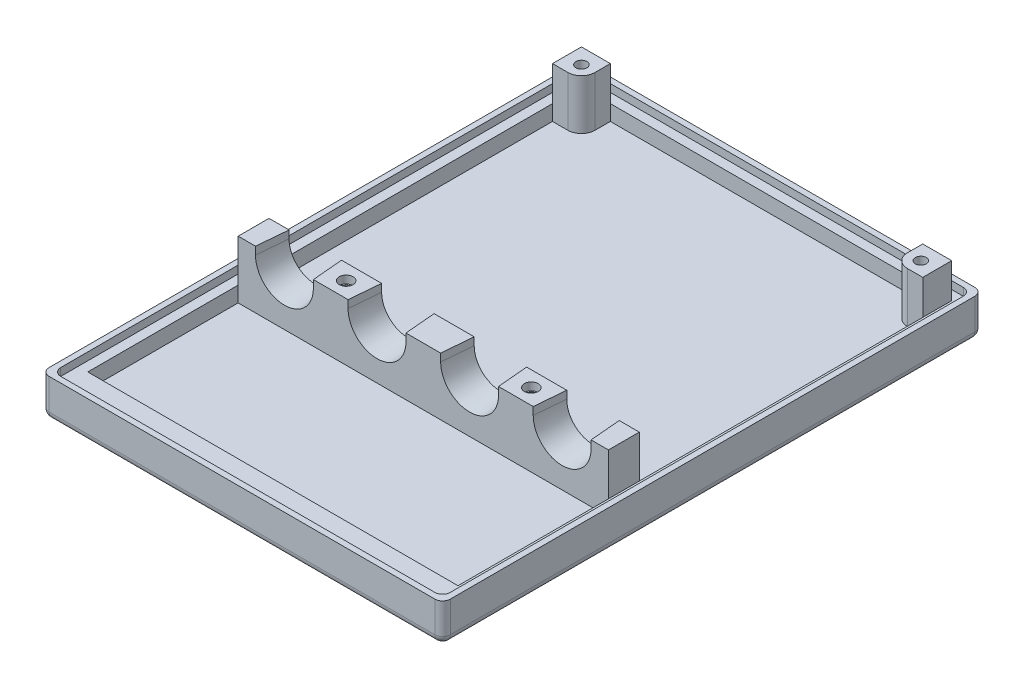
from build123d import *

# Parameters (mm, degrees)
SKETCH1_W                     = 82.55
SKETCH1_H                     = 111.125
BOSS_EXTRUDE1_DEPTH           = 7.9375
SKETCH3_W                     = 76.2
SKETCH3_H                     = 101.6
CUT_EXTRUDE1_DEPTH            = 4.7625
SKETCH4_W                     = 76.2
SKETCH4_H                     = 6.35
BOSS_EXTRUDE2_DEPTH           = 4.7625
SKETCH5_W                     = 76.2
SKETCH5_H                     = 6.35
BOSS_EXTRUDE3_DEPTH           = 5.5499
SKETCH7_R                     = 5.953125
CUT_EXTRUDE2_DEPTH            = 6.35
CUT_EXTRUDE2_DRAFT            = -5
CUT_EXTRUDE2_PROFILE_2_DEPTH  = 6.35
CUT_EXTRUDE2_PROFILE_2_DRAFT  = -5
CUT_EXTRUDE2_PROFILE_3_DEPTH  = 6.35
CUT_EXTRUDE2_PROFILE_3_DRAFT  = -5
CUT_EXTRUDE2_PROFILE_4_DEPTH  = 6.35
CUT_EXTRUDE2_PROFILE_4_DRAFT  = -5
FILLET1_R                     = 1.5875
F_4_40_TAPPED_HOLE4_D         = 2.2606
F_4_40_TAPPED_HOLE4_DEPTH     = 5.588
F_4_40_TAPPED_HOLE4_TIP       = 0.679152758
SKETCH29_W                    = 80.16875
SKETCH29_H                    = 108.74375
SKETCH29_W_2                  = 76.2
SKETCH29_H_2                  = 101.6
CUT_EXTRUDE8_DEPTH            = 1.5875
FILLET3_R                     = 1.5875
BOSS_EXTRUDE11_DEPTH          = 1.5875
F_4_40_START                  = 13.4874
F_4_40_TAPPED_HOLE7_OUTLINE_R = 1.4224
F_4_40_TAPPED_HOLE7_DEPTH     = 1.5875
SKETCH42_W                    = 0.652371877
SKETCH42_H                    = 1.304778899
SKETCH42_W_2                  = 0.652345509
SKETCH42_W_3                  = 0.652363072
SKETCH42_H_2                  = 1.304668087
SKETCH42_W_4                  = 0.978571653
SKETCH42_H_3                  = 0.65256534
SKETCH42_W_5                  = 3.914136188
SKETCH42_H_4                  = 1.304397517
CUT_EXTRUDE11_DEPTH           = 0.79375
SKETCH44_W                    = 0.326213032
SKETCH44_H                    = 0.326144875
BOSS_EXTRUDE13_DEPTH          = 0.79375
SKETCH44_W_2                  = 1.304696491
SKETCH44_H_2                  = 0.652319029
BOSS_EXTRUDE13_2_DEPTH        = 0.79375
SKETCH44_W_3                  = 4.566463461
SKETCH44_H_3                  = 0.6524024
BOSS_EXTRUDE13_3_DEPTH        = 0.79375
BOSS_EXTRUDE13_4_DEPTH        = 0.79375


# Read off the part's stored shape, not the designer's step: #4-40 Tapped Hole7
with BuildPart() as part:
    # Sketch1 → Boss-Extrude1 (new body)
    with BuildSketch(Plane(origin=(0, 0, 0), x_dir=(1, 0, 0), z_dir=(0, 1, 0))):
        Rectangle(SKETCH1_W, SKETCH1_H)
    extrude(amount=BOSS_EXTRUDE1_DEPTH)

    # Sketch3 → Cut-Extrude1 (cut)
    with BuildSketch(Plane(origin=(0, 7.9375, 0), x_dir=(-1, 0, 0), z_dir=(0, 1, 0))):
        with Locations((0, -1.5875)):
            Rectangle(SKETCH3_W, SKETCH3_H)
    extrude(amount=-CUT_EXTRUDE1_DEPTH, mode=Mode.SUBTRACT)

    # Sketch4 → Boss-Extrude2 (add)
    with BuildSketch(Plane(origin=(0, 3.175, 0), x_dir=(-1, 0, 0), z_dir=(0, 1, 0))):
        with Locations((0, 15.08125)):
            Rectangle(SKETCH4_W, SKETCH4_H)
        with BuildLine():
            Line((34.925, -46.434375), (38.1, -46.434375))
            Line((38.1, -46.434375), (38.1, -52.3875))
            Line((38.1, -52.3875), (32.146875, -52.3875))
            Line((32.146875, -52.3875), (32.146875, -49.2125))
            ThreePointArc((32.146875, -49.2125), (32.960568974, -47.248068974), (34.925, -46.434375))
        make_face()
        with BuildLine():
            Line((-32.146875, -49.2125), (-32.146875, -52.3875))
            Line((-32.146875, -52.3875), (-38.1, -52.3875))
            Line((-38.1, -52.3875), (-38.1, -46.434375))
            Line((-38.1, -46.434375), (-34.925, -46.434375))
            ThreePointArc((-34.925, -46.434375), (-32.960568974, -47.248068974), (-32.146875, -49.2125))
        make_face()
    extrude(amount=BOSS_EXTRUDE2_DEPTH)

    # Sketch5 → Boss-Extrude3 (add)
    with BuildSketch(Plane(origin=(0, 7.9375, 0), x_dir=(-1, 0, 0), z_dir=(0, 1, 0))):
        with Locations((0, 15.08125)):
            Rectangle(SKETCH5_W, SKETCH5_H)
        with BuildLine():
            Line((34.925, -46.434375), (38.1, -46.434375))
            Line((38.1, -46.434375), (38.1, -52.3875))
            Line((38.1, -52.3875), (32.146875, -52.3875))
            Line((32.146875, -52.3875), (32.146875, -49.2125))
            ThreePointArc((32.146875, -49.2125), (32.960568974, -47.248068974), (34.925, -46.434375))
        make_face()
        with BuildLine():
            Line((-32.146875, -49.2125), (-32.146875, -52.3875))
            Line((-32.146875, -52.3875), (-38.1, -52.3875))
            Line((-38.1, -52.3875), (-38.1, -46.434375))
            Line((-38.1, -46.434375), (-34.925, -46.434375))
            ThreePointArc((-34.925, -46.434375), (-32.960568974, -47.248068974), (-32.146875, -49.2125))
        make_face()
    extrude(amount=BOSS_EXTRUDE3_DEPTH)


with BuildPart() as cut_extrude2_tool:
    # Sketch7 → Cut-Extrude2 (with draft: the straight prism first)
    with BuildSketch(Plane.XY.offset(18.25625)):
        with Locations((-28.575, 13.4874)):
            Circle(SKETCH7_R)
    extrude(amount=-CUT_EXTRUDE2_DEPTH)
    # Cut-Extrude2: the draft: its side faces are tilted about the plane it starts from
    cut_extrude2_sides = [cut_extrude2_tool.faces().sort_by_distance(p)[0] for p in [
        (-34.528125, 13.4874, 15.08125),
    ]]
    draft(cut_extrude2_sides, Plane.XY.offset(18.25625), CUT_EXTRUDE2_DRAFT)


with BuildPart() as part_1:
    add(part.part)

    # Cut-Extrude2: cut by cut_extrude2_tool
    add(cut_extrude2_tool.part, mode=Mode.SUBTRACT)


with BuildPart() as cut_extrude2_profile_2_tool:
    # Sketch7 → Cut-Extrude2 profile 2 (with draft: the straight prism first)
    with BuildSketch(Plane.XY.offset(18.25625)):
        with Locations((-9.525, 13.4874)):
            Circle(SKETCH7_R)
    extrude(amount=-CUT_EXTRUDE2_PROFILE_2_DEPTH)
    # Cut-Extrude2 profile 2: the draft: its side faces are tilted about the plane it starts from
    cut_extrude2_profile_2_sides = [cut_extrude2_profile_2_tool.faces().sort_by_distance(p)[0] for p in [
        (-15.478125, 13.4874, 15.08125),
    ]]
    draft(cut_extrude2_profile_2_sides, Plane.XY.offset(18.25625), CUT_EXTRUDE2_PROFILE_2_DRAFT)


with BuildPart() as part_2:
    add(part_1.part)

    # Cut-Extrude2 profile 2: cut by cut_extrude2_profile_2_tool
    add(cut_extrude2_profile_2_tool.part, mode=Mode.SUBTRACT)


with BuildPart() as cut_extrude2_profile_3_tool:
    # Sketch7 → Cut-Extrude2 profile 3 (with draft: the straight prism first)
    with BuildSketch(Plane.XY.offset(18.25625)):
        with Locations((9.525, 13.4874)):
            Circle(SKETCH7_R)
    extrude(amount=-CUT_EXTRUDE2_PROFILE_3_DEPTH)
    # Cut-Extrude2 profile 3: the draft: its side faces are tilted about the plane it starts from
    cut_extrude2_profile_3_sides = [cut_extrude2_profile_3_tool.faces().sort_by_distance(p)[0] for p in [
        (3.571875, 13.4874, 15.08125),
    ]]
    draft(cut_extrude2_profile_3_sides, Plane.XY.offset(18.25625), CUT_EXTRUDE2_PROFILE_3_DRAFT)


with BuildPart() as part_3:
    add(part_2.part)

    # Cut-Extrude2 profile 3: cut by cut_extrude2_profile_3_tool
    add(cut_extrude2_profile_3_tool.part, mode=Mode.SUBTRACT)


with BuildPart() as cut_extrude2_profile_4_tool:
    # Sketch7 → Cut-Extrude2 profile 4 (with draft: the straight prism first)
    with BuildSketch(Plane.XY.offset(18.25625)):
        with Locations((28.575, 13.4874)):
            Circle(SKETCH7_R)
    extrude(amount=-CUT_EXTRUDE2_PROFILE_4_DEPTH)
    # Cut-Extrude2 profile 4: the draft: its side faces are tilted about the plane it starts from
    cut_extrude2_profile_4_sides = [cut_extrude2_profile_4_tool.faces().sort_by_distance(p)[0] for p in [
        (22.621875, 13.4874, 15.08125),
    ]]
    draft(cut_extrude2_profile_4_sides, Plane.XY.offset(18.25625), CUT_EXTRUDE2_PROFILE_4_DRAFT)


with BuildPart() as part_4:
    add(part_3.part)

    # Cut-Extrude2 profile 4: cut by cut_extrude2_profile_4_tool
    add(cut_extrude2_profile_4_tool.part, mode=Mode.SUBTRACT)

    # Fillet1
    fillet1_edges = [part_4.edges().sort_by_distance(p)[0] for p in [
        (0, 0, 55.5625),
        (-41.275, 0, 0),
        (0, 0, -55.5625),
        (41.275, 0, 0),
        (41.275, 3.96875, 55.5625),
        (-41.275, 3.96875, 55.5625),
        (-41.275, 3.96875, -55.5625),
        (41.275, 3.96875, -55.5625),
    ]]
    fillet(fillet1_edges, radius=FILLET1_R)

    # #4-40 Tapped Hole4
    with Locations(Plane(origin=(0, 13.4874, 0), x_dir=(-1, 0, 0), z_dir=(0, 1, 0))):
        with Locations((-19.05, 15.08125), (19.05, 15.08125), (34.925, -49.2125), (-34.925, -49.2125)):
            Hole(F_4_40_TAPPED_HOLE4_D / 2, depth=F_4_40_TAPPED_HOLE4_DEPTH)
            with Locations((0, 0, -(F_4_40_TAPPED_HOLE4_DEPTH + F_4_40_TAPPED_HOLE4_TIP / 2))):  # 118° drill point
                Cone(0, F_4_40_TAPPED_HOLE4_D / 2, F_4_40_TAPPED_HOLE4_TIP, mode=Mode.SUBTRACT)

    # Sketch29 → Cut-Extrude8 (cut)
    with BuildSketch(Plane(origin=(0, 7.9375, 0), x_dir=(1, 0, 0), z_dir=(0, 1, 0))):
        Rectangle(SKETCH29_W, SKETCH29_H)
        with Locations((0, 1.5875)):
            Rectangle(SKETCH29_W_2, SKETCH29_H_2, mode=Mode.SUBTRACT)
    extrude(amount=-CUT_EXTRUDE8_DEPTH, mode=Mode.SUBTRACT)

    # Fillet3
    fillet3_edges = [part_4.edges().sort_by_distance(p)[0] for p in [
        (-40.084375, 7.14375, 54.371875),
        (-40.084375, 7.14375, -54.371875),
        (40.084375, 7.14375, -54.371875),
        (40.084375, 7.14375, 54.371875),
    ]]
    fillet(fillet3_edges, radius=FILLET3_R)

    # Sketch30 → Boss-Extrude11 (add)
    with BuildSketch(Plane(origin=(0, 13.4874, 0), x_dir=(1, 0, 0), z_dir=(0, 1, 0))):
        Polygon((-38.1, -18.25625), (-38.1, -11.90625), (-33.972571987, -11.90625), (-34.528125, -18.25625), align=None)
        Polygon((-23.177428013, -11.90625), (-22.621875, -18.25625), (-15.478125, -18.25625), (-14.922571987, -11.90625), align=None)
        Polygon((-3.571875, -18.25625), (-4.127428013, -11.90625), (4.127428013, -11.90625), (3.571875, -18.25625), align=None)
        Polygon((14.922571987, -11.90625), (15.478125, -18.25625), (22.621875, -18.25625), (23.177428013, -11.90625), align=None)
        Polygon((34.528125, -18.25625), (33.972571987, -11.90625), (38.1, -11.90625), (38.1, -18.25625), align=None)
    extrude(amount=BOSS_EXTRUDE11_DEPTH)

    # #4-40 Tapped Hole7 outline → #4-40 Tapped Hole7 (cut)
    with BuildSketch(Plane(origin=(0, 0, 0), x_dir=(1, 0, 0), z_dir=(0, 1, 0)).offset(F_4_40_START)):
        with Locations((-19.05, -15.08125)):
            Circle(F_4_40_TAPPED_HOLE7_OUTLINE_R)
        with Locations((19.05, -15.08125)):
            Circle(F_4_40_TAPPED_HOLE7_OUTLINE_R)
    extrude(amount=F_4_40_TAPPED_HOLE7_DEPTH, mode=Mode.SUBTRACT)

    # Sketch42 → Cut-Extrude11 (cut)
    # profile 1 of 6: a face of its own
    with BuildSketch(Plane.XZ):
        Polygon((21.52786438, 49.095158812), (21.52786438, 49.747412975), (17.613762583, 49.747412975), (17.613762583, 49.095158812), (15.982640443, 49.095158812), (15.982640443, 48.442805819), (15.65674839, 48.442805819), (15.65674839, 47.79035261), (15.004300643, 47.79035261), (15.004300643, 47.138163453), (14.02580479, 47.138163453), (14.02580479, 46.159582391), (13.699694322, 46.159582391), (13.699694322, 43.87627962), (15.004300643, 43.87627962), (15.004300643, 43.22390251), (13.699694322, 43.22390251), (13.699694322, 42.571564003), (15.65674839, 42.571564003), (15.65674839, 43.22390251), (17.613762583, 43.22390251), (17.613762583, 43.87627962), (18.918441604, 43.87627962), (18.918441604, 43.22390251), (19.570813481, 43.22390251), (19.570813481, 42.571564003), (20.875494623, 42.571564003), (20.875494623, 41.266910749), (22.832550279, 41.266910749), (22.832550279, 42.571564003), (24.137276942, 42.571564003), (24.137276942, 43.22390251), (24.789622451, 43.22390251), (24.789622451, 43.87627962), (26.094258807, 43.87627962), (26.094258807, 43.22390251), (28.051360777, 43.22390251), (28.051360777, 42.571564003), (30.008315933, 42.571564003), (30.008315933, 43.22390251), (28.703713455, 43.22390251), (28.703713455, 43.87627962), (30.008315933, 43.87627962), (30.008315933, 46.159582391), (29.682222021, 46.159582391), (29.682222021, 47.138163453), (28.703713455, 47.138163453), (28.703713455, 47.79035261), (28.051360777, 47.79035261), (28.051360777, 48.442805819), (27.725230364, 48.442805819), (27.725230364, 49.095158812), (26.094258807, 49.095158812), (26.094258807, 49.747412975), (22.180090473, 49.747412975), (22.180090473, 49.095158812), align=None)
        with Locations((19.244627543, 46.485774004)):
            Rectangle(SKETCH42_W, SKETCH42_H, mode=Mode.SUBTRACT)
        with Locations((24.463449696, 46.485774004)):
            Rectangle(SKETCH42_W_2, SKETCH42_H, mode=Mode.SUBTRACT)
    # profile 2 of 6: a face of its own
    with BuildSketch(Plane.XZ):
        Polygon((18.918441604, 40.6147146), (18.918441604, 41.266910749), (17.613762583, 41.266910749), (17.613762583, 40.6147146), (15.65674839, 40.6147146), (15.65674839, 39.310295409), (15.004300643, 39.310295409), (15.004300643, 37.352836748), (17.613762583, 37.352836748), (17.613762583, 38.657498194), (18.918441604, 38.657498194), (18.918441604, 39.310295409), (19.570813481, 39.310295409), (19.570813481, 40.6147146), align=None)
    # profile 3 of 6: a face of its own
    with BuildSketch(Plane.XZ):
        Polygon((24.789622451, 40.6147146), (24.137276942, 40.6147146), (24.137276942, 39.310295409), (24.789622451, 39.310295409), (24.789622451, 38.657498194), (26.094258807, 38.657498194), (26.094258807, 37.352836748), (28.703713455, 37.352836748), (28.703713455, 39.310295409), (28.051360777, 39.310295409), (28.051360777, 40.6147146), (26.094258807, 40.6147146), (26.094258807, 41.266910749), (24.789622451, 41.266910749), align=None)
    # profile 4 of 6: a face of its own
    with BuildSketch(Plane.XZ):
        Polygon((13.047415639, 36.048068649), (13.047415639, 45.180982154), (11.741976241, 45.180982154), (11.741976241, 40.288667913), (11.416485788, 40.288667913), (11.416485788, 40.6147146), (11.090332821, 40.6147146), (11.090332821, 41.266910749), (9.133300593, 41.266910749), (9.133300593, 40.6147146), (8.807101435, 40.6147146), (8.807101435, 40.288667913), (8.480909146, 40.288667913), (8.480909146, 37.678984726), (8.807101435, 37.678984726), (8.807101435, 37.352836748), (9.133300593, 37.352836748), (9.133300593, 36.700433657), (10.437959912, 36.700433657), (10.437959912, 36.048068649), (11.090332821, 36.048068649), (11.090332821, 30.829312083), (11.741976241, 30.829312083), (11.741976241, 28.872828196), (13.047415639, 28.872828196), (13.047415639, 28.219931943), (13.699694322, 28.219931943), (13.699694322, 26.262905497), (13.047415639, 26.262905497), (13.047415639, 23.979673324), (13.699694322, 23.979673324), (13.699694322, 24.305829125), (14.02580479, 24.305829125), (14.02580479, 24.958181319), (14.678252935, 24.958181319), (14.678252935, 25.284476533), (15.65674839, 25.284476533), (15.65674839, 25.610530377), (16.308877073, 25.610530377), (16.308877073, 24.958181319), (17.613762583, 24.958181319), (17.613762583, 23.653543261), (20.223176553, 23.653543261), (20.223176553, 22.674981896), (22.832550279, 22.674981896), (22.832550279, 23.653543261), (26.094258807, 23.653543261), (26.094258807, 24.958181319), (27.398995055, 24.958181319), (27.398995055, 25.610530377), (28.051360777, 25.610530377), (28.051360777, 25.284355848), (29.029868348, 25.284355848), (29.029868348, 24.958181319), (29.682222021, 24.958181319), (29.682222021, 24.30586229), (30.008315933, 24.30586229), (30.008315933, 23.979673324), (30.66072387, 23.979673324), (30.66072387, 26.589053875), (30.334519902, 26.589053875), (30.334519902, 27.567589573), (30.008315933, 27.567589573), (30.008315933, 28.546380069), (30.334519902, 28.546380069), (30.334519902, 28.219931943), (30.66072387, 28.219931943), (30.66072387, 28.546380069), (35.879530872, 28.546380069), (35.879530872, 30.503144624), (31.965490761, 30.503144624), (31.965490761, 30.829312083), (32.617767196, 30.829312083), (32.617767196, 33.765087172), (33.922510816, 33.765087172), (33.922510816, 32.460220717), (35.879530872, 32.460220717), (35.879530872, 35.721895492), (32.617767196, 35.721895492), (32.617767196, 36.048068649), (33.270139006, 36.048068649), (33.270139006, 36.700433657), (34.57482824, 36.700433657), (34.57482824, 37.352836748), (34.901020844, 37.352836748), (34.901020844, 37.678984726), (35.227156142, 37.678984726), (35.227156142, 40.6147146), (34.57482824, 40.6147146), (34.57482824, 41.266910749), (32.617767196, 41.266910749), (32.617767196, 37.352836748), (31.313077813, 37.352836748), (31.313077813, 45.180982154), (30.66072387, 45.180982154), (30.66072387, 36.048068649), (26.746626931, 36.048068649), (26.746626931, 36.700433657), (16.961319828, 36.700433657), (16.961319828, 36.048068649), align=None)
        with Locations((19.896995017, 24.958196333)):
            Rectangle(SKETCH42_W_3, SKETCH42_H_2, mode=Mode.SUBTRACT)
        Polygon((19.570813481, 27.567589573), (19.570813481, 26.262905497), (18.266116075, 26.262905497), (18.266116075, 25.610530377), (16.635290679, 25.610530377), (16.635290679, 26.262905497), (17.287636184, 26.262905497), (17.287636184, 26.589053875), (17.613762583, 26.589053875), (17.613762583, 27.567589573), (18.918469568, 27.567589573), (18.918469568, 27.893760758), (19.570813481, 27.893760758), (19.570813481, 28.219931943), (20.223176553, 28.219931943), (20.223176553, 27.567589573), align=None, mode=Mode.SUBTRACT)
        Polygon((15.65674839, 30.829525149), (15.65674839, 30.503144624), (14.352036812, 30.503144624), (14.352036812, 31.155454905), (16.961319828, 31.155454905), (16.961319828, 30.829525149), align=None, mode=Mode.SUBTRACT)
        Polygon((20.549385134, 28.872828196), (13.699694322, 28.872828196), (13.699694322, 29.850820219), (14.02580479, 29.850820219), (14.02580479, 30.177326391), (19.244668598, 30.177326391), (19.244668598, 31.481723908), (14.02580479, 31.481723908), (14.02580479, 35.395945156), (20.549385134, 35.395945156), (20.549385134, 34.743380752), (20.875494623, 34.743380752), (20.875494623, 35.395945156), (23.158757296, 35.395945156), (23.158757296, 35.069555122), (23.484878645, 35.069555122), (23.484878645, 35.395945156), (24.463410435, 35.395945156), (24.463410435, 35.069555122), (25.115795813, 35.069555122), (25.115795813, 34.743380752), (25.768100582, 34.743380752), (25.768100582, 33.765087172), (26.420484889, 33.765087172), (26.420484889, 33.112521832), (24.463410435, 33.112521832), (24.463410435, 34.091049747), (24.137276942, 34.091049747), (24.137276942, 34.743380752), (23.811077373, 34.743380752), (23.811077373, 33.438718742), (23.484878645, 33.438718742), (23.484878645, 34.091086578), (23.158757296, 34.091086578), (23.158757296, 32.786350905), (27.072893484, 32.786350905), (27.072893484, 35.395945156), (28.376789635, 35.395945156), (28.376789635, 31.808104474), (29.029868348, 31.808104474), (29.029868348, 31.155454905), (29.356044041, 31.155454905), (29.356044041, 30.829312083), (29.682222021, 30.829312083), (29.682222021, 30.503144624), (28.703713455, 30.503144624), (28.703713455, 30.177326391), (28.376789635, 30.177326391), (28.376789635, 28.872828196), (21.853973379, 28.872828196), (21.853973379, 34.743380752), (21.201715671, 34.743380752), (21.201715671, 34.417222427), (20.875494623, 34.417222427), (20.875494623, 34.091086578), (18.592229549, 34.091086578), (18.592229549, 33.765087172), (18.266116075, 33.765087172), (18.266116075, 32.786350905), (20.549385134, 32.786350905), align=None, mode=Mode.SUBTRACT)
        with Locations((20.060099308, 33.438804502)):
            Rectangle(SKETCH42_W_4, SKETCH42_H_3, mode=Mode.SUBTRACT)
        Polygon((22.832550279, 24.30586229), (21.853973379, 24.30586229), (21.853973379, 24.632021804), (22.180090473, 24.632021804), (22.180090473, 25.610530377), (23.158757296, 25.610530377), (23.158757296, 25.284355848), (22.832550279, 25.284355848), align=None, mode=Mode.SUBTRACT)
        Polygon((35.5526539, 28.872828196), (29.029868348, 28.872828196), (29.029868348, 30.177326391), (30.334519902, 30.177326391), (30.334519902, 35.395945156), (35.5526539, 35.395945156), (35.5526539, 32.786635774), (34.248638224, 32.786635774), (34.248638224, 34.091290465), (31.639081198, 34.091290465), (31.639081198, 30.177326391), (35.5526539, 30.177326391), align=None, mode=Mode.SUBTRACT)
    # profile 5 of 6: a face of its own
    with BuildSketch(Plane.XZ):
        Polygon((15.33059445, 32.786350905), (16.635236694, 32.786350905), (16.635236694, 33.112521832), (16.961319828, 33.112521832), (16.961319828, 33.765087172), (17.613762583, 33.765087172), (17.613762583, 34.091086578), (15.33059445, 34.091086578), align=None)
    # profile 6 of 6: a face of its own
    with BuildSketch(Plane.XZ):
        with Locations((25.11582539, 30.82952515)):
            Rectangle(SKETCH42_W_5, SKETCH42_H_4)
    extrude(amount=-CUT_EXTRUDE11_DEPTH, mode=Mode.SUBTRACT)


with BuildPart() as body_2:
    # Sketch44 → Boss-Extrude13 (new body)
    with BuildSketch(Plane.XZ.offset(-0.79375)):
        with Locations((13.862800838, 28.383004381)):
            Rectangle(SKETCH44_W, SKETCH44_H)
    extrude(amount=BOSS_EXTRUDE13_DEPTH)


with BuildPart() as body_3:
    # Sketch44 → Boss-Extrude13 2 (new body)
    with BuildSketch(Plane.XZ.offset(-0.79375)):
        with Locations((20.875524799, 23.979702776)):
            Rectangle(SKETCH44_W_2, SKETCH44_H_2)
    extrude(amount=BOSS_EXTRUDE13_2_DEPTH)


with BuildPart() as body_4:
    # Sketch44 → Boss-Extrude13 3 (new body)
    with BuildSketch(Plane.XZ.offset(-0.79375)):
        with Locations((21.854045212, 45.507183354)):
            Rectangle(SKETCH44_W_3, SKETCH44_H_3)
    extrude(amount=BOSS_EXTRUDE13_3_DEPTH)


with BuildPart() as body_5:
    # Sketch44 → Boss-Extrude13 4 (new body)
    with BuildSketch(Plane.XZ.offset(-0.79375)):
        Polygon((23.158757296, 25.610530377), (23.158757296, 25.936702143), (24.137276942, 25.936702143), (24.137276942, 26.589053875), (24.463410435, 26.589053875), (24.463410435, 27.241407232), (24.137276942, 27.241407232), (24.137276942, 27.567589573), (22.832550279, 27.567589573), (22.832550279, 28.219931943), (23.484913611, 28.219931943), (23.484913611, 27.893760758), (24.789603124, 27.893760758), (24.789603124, 27.567589573), (25.441948198, 27.567589573), (25.441948198, 26.915230554), (26.094292736, 26.915230554), (26.094292736, 26.589053875), (26.746626931, 26.589053875), (26.746626931, 25.936702143), (27.398995055, 25.936702143), (27.398995055, 25.610530377), align=None)
    extrude(amount=BOSS_EXTRUDE13_4_DEPTH)


solid = Compound([part_4.part, body_2.part, body_3.part, body_4.part, body_5.part])
